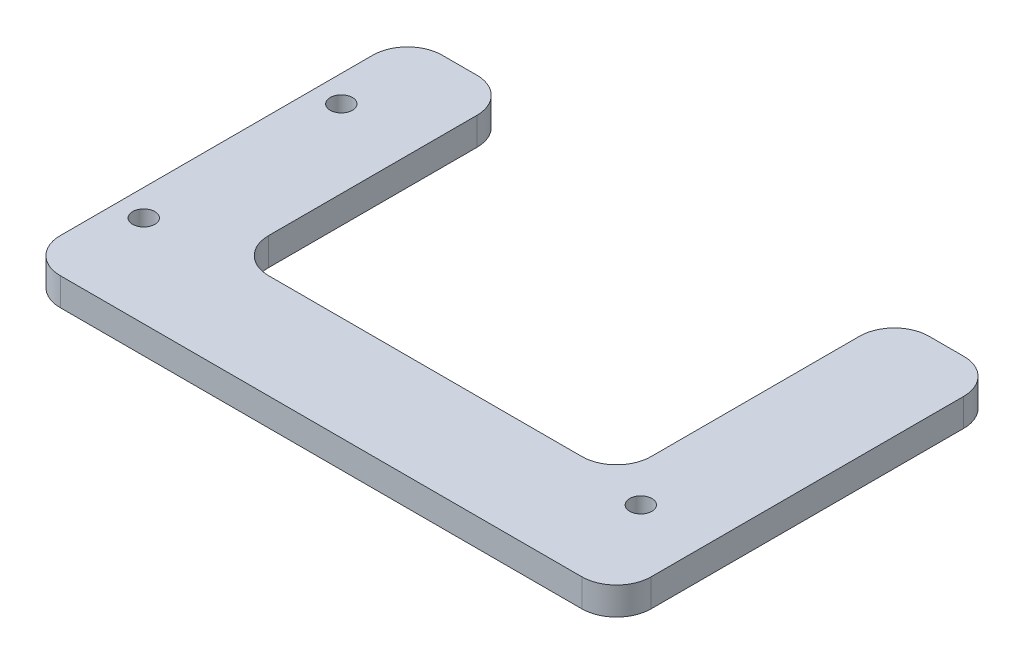
from build123d import *

# Parameters (mm, degrees)
SKETCH_1_W          = 85.1
SKETCH_1_H          = 55
SKETCH_1_R          = 1.6
EXTRUDE_1_DEPTH     = 4
CUT_EXTRUDE_2_REACH = 52.821
SKETCH_3_W          = 55.1
SKETCH_3_H          = 40
FILLET_1_R          = 5


with BuildPart() as part:
    # 草图1 → 凸台-拉伸1 (new body)
    with BuildSketch(Plane(origin=(0, 0, 0), x_dir=(1, 0, 0), z_dir=(0, 1, 0))):
        Rectangle(SKETCH_1_W, SKETCH_1_H)
        with Locations((-38.74, 14.16)):
            Circle(SKETCH_1_R, mode=Mode.SUBTRACT)
        with Locations((-38.74, -14.29)):
            Circle(SKETCH_1_R, mode=Mode.SUBTRACT)
        with Locations((32.84, -14.29)):
            Circle(SKETCH_1_R, mode=Mode.SUBTRACT)
    extrude(amount=EXTRUDE_1_DEPTH)

    # 草图3 → 切除-拉伸2 (cut, up to next)
    with BuildSketch(Plane(origin=(0, 0, 0), x_dir=(1, 0, 0), z_dir=(0, 1, 0)), mode=Mode.PRIVATE) as cut_extrude_2_sk1:
        with Locations((0, 7.5)):
            Rectangle(SKETCH_3_W, SKETCH_3_H)
    cut_extrude_2_tool1 = extrude(cut_extrude_2_sk1.sketch, amount=CUT_EXTRUDE_2_REACH, mode=Mode.PRIVATE) & part.part
    add(cut_extrude_2_tool1.solids().sort_by_distance((0, 0, -7.5))[0], mode=Mode.SUBTRACT)

    # 圆角1
    fillet_1_edges = [part.edges().sort_by_distance(p)[0] for p in [
        (27.55, 2, 12.5),
        (27.55, 2, -27.5),
        (42.55, 2, -27.5),
        (42.55, 2, 27.5),
        (-42.55, 2, 27.5),
        (-27.55, 2, 12.5),
        (-42.55, 2, -27.5),
        (-27.55, 2, -27.5),
    ]]
    fillet(fillet_1_edges, radius=FILLET_1_R)


solid = part.part
